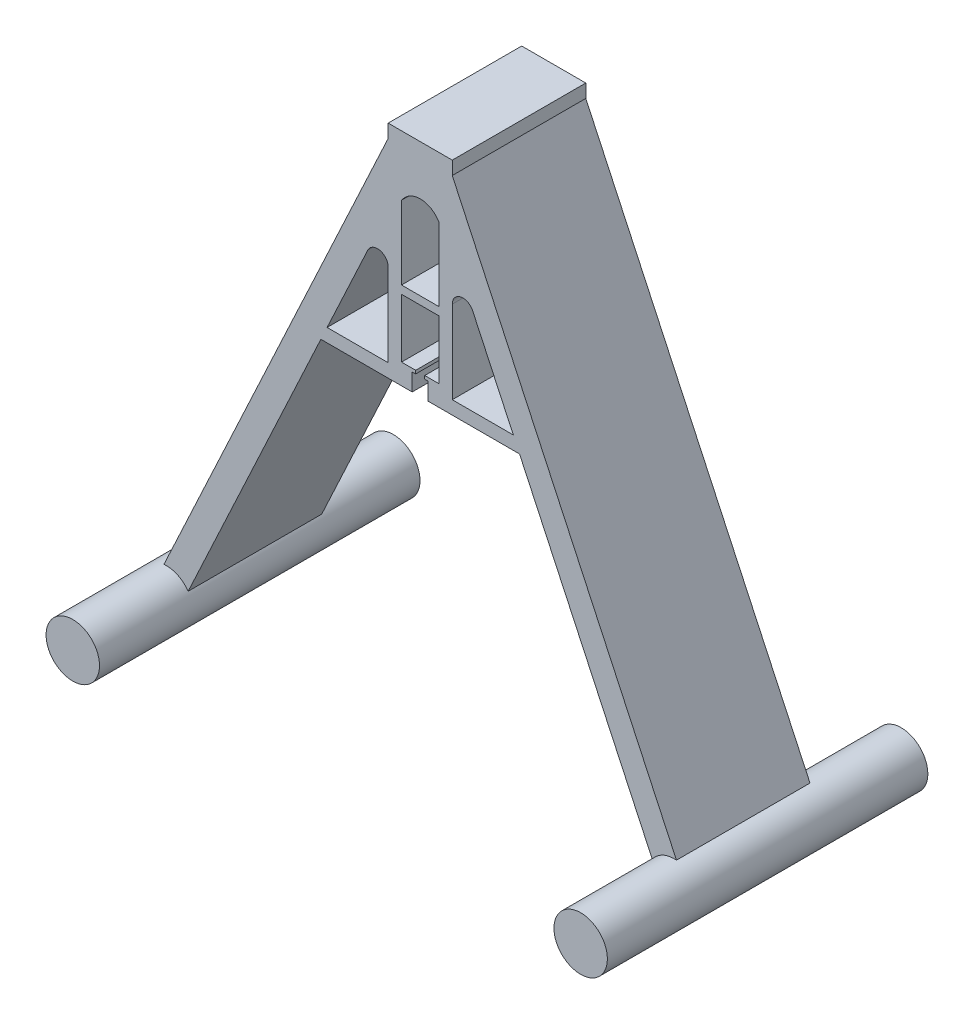
from build123d import *
from build123d.topology import SkipClean

# Parameters (mm, degrees)
BOSS_EXTRUDE1_DEPTH     = 50
BOSS_EXTRUDE3_START     = -85
BOSS_EXTRUDE3_OUTLINE_R = 10
BOSS_EXTRUDE3_DEPTH     = 120
FILLET1_R               = 8
BOSS_EXTRUDE5_DEPTH     = 50
FILLET2_R               = 8
FILLET3_R               = 4
BOSS_EXTRUDE6_DEPTH     = 50
SKETCH7_W               = 50
SKETCH7_H               = 3
BOSS_EXTRUDE7_DEPTH     = 14


with BuildPart() as part:
    # Sketch1 → Boss-Extrude1 (new body)
    with BuildSketch(Plane.XY):
        with BuildLine():
            Line((-12, -26.162016), (-12, -72.5))
            Line((-12, -72.5), (-12, -80.2))
            Line((-12, -80.2), (-3, -80.2))
            Line((-3, -80.2), (-3, -73.7))
            Line((-3, -73.7), (-1.7, -73.7))
            Line((-1.7, -73.7), (-1.7, -72.5))
            Line((-1.7, -72.5), (-7, -72.5))
            Line((-7, -72.5), (-7, -15.439481))
            Line((-7, -15.439481), (0, -0.427933))
            Line((0, -0.427933), (7, -15.439481))
            Line((7, -15.439481), (7, -72.5))
            Line((7, -72.5), (1.7, -72.5))
            Line((1.7, -72.5), (1.7, -73.7))
            Line((1.7, -73.7), (3, -73.7))
            Line((3, -73.7), (3, -80.2))
            Line((3, -80.2), (12, -80.2))
            Line((12, -80.2), (12, -72.5))
            Line((12, -72.5), (12, -26.162016))
            Line((12, -26.162016), (86.890045, -186.764236))
            ThreePointArc((86.890045, -186.764236), (99.307748, -201.563078), (95.953123, -182.538053))
            Line((95.953123, -182.538053), (12, -2.5))
            Line((12, -2.5), (12, 2.5))
            Line((12, 2.5), (-12, 2.5))
            Line((-12, 2.5), (-12, -2.5))
            Line((-12, -2.5), (-95.953123, -182.538053))
            ThreePointArc((-95.953123, -182.538053), (-99.307748, -201.563078), (-86.890045, -186.764236))
            Line((-86.890045, -186.764236), (-12, -26.162016))
        make_face()
    extrude(amount=-BOSS_EXTRUDE1_DEPTH)

    # Boss-Extrude3: read off the stored shape, not the designer's step
    # Boss-Extrude3 outline → Boss-Extrude3 (add)
    with SkipClean():  # the faces are left unmerged after this step: merging them gives an invalid solid
        with BuildSketch(Plane.XY.offset(BOSS_EXTRUDE3_START)):
            with Locations((-95.081565, -192.5)):
                Circle(BOSS_EXTRUDE3_OUTLINE_R)
            with Locations((95.081565, -192.5)):
                Circle(BOSS_EXTRUDE3_OUTLINE_R)
        extrude(amount=BOSS_EXTRUDE3_DEPTH)

    # Fillet1
    # the kernel refuses this fillet: 8 mm, written as the material it adds along each edge
    with BuildSketch(Plane(origin=(0, -0.427933, 0), x_dir=(0.42261826174070033, -0.9063077870366496, 0), z_dir=(0, 0, -1))) as fillet1_piece_1:
        with BuildLine():
            CenterArc((17.12902, 8), FILLET1_R, 144.123602, 125.876398)
            Line((10.646755, 12.688309), (10.51711, 12.782075))
            ThreePointArc((10.51711, 12.782075), (5.200811, 6.447001), (-0.122567, 0.102846))
            Line((-0.122567, 0.102846), (0, -0.16))
            Line((0, -0.16), (17.12902, -0.16))
            Line((17.12902, -0.16), (17.12902, 0))
        make_face()
    extrude(amount=50)

    # Sketch5 → Boss-Extrude5 (add)
    with BuildSketch(Plane.XY):
        Polygon((-12, -26.162016), (0.012175, -11.333078), (12, -26.162016), (12, -2.5), (-12, -2.5), align=None)
    extrude(amount=-BOSS_EXTRUDE5_DEPTH)

    # Fillet2
    fillet2_edges = [part.edges().sort_by_distance(p)[0] for p in [
        (0.012175, -11.333078, -25),
    ]]
    fillet(fillet2_edges, radius=FILLET2_R)

    # Fillet3
    fillet3_edges = [part.edges().sort_by_distance(p)[0] for p in [
        (-12, -26.162016, -25),
        (12, -26.162016, -25),
    ]]
    fillet(fillet3_edges, radius=FILLET3_R)

    # Sketch6 → Boss-Extrude6 (add)
    with BuildSketch(Plane.XY):
        Polygon((-12, -80.2), (-37.198326, -80.2), (-34.866788, -75.2), (-12, -75.2), align=None)
        Polygon((12, -75.2), (12, -80.2), (37.198326, -80.2), (34.866788, -75.2), align=None)
    extrude(amount=-BOSS_EXTRUDE6_DEPTH)

    # Sketch7 → Boss-Extrude7 (add)
    with BuildSketch(Plane(origin=(-7, 0, 0), x_dir=(0, 0, -1), z_dir=(1, 0, 0))):
        with Locations((25, -49)):
            Rectangle(SKETCH7_W, SKETCH7_H)
    extrude(amount=BOSS_EXTRUDE7_DEPTH)


solid = part.part
